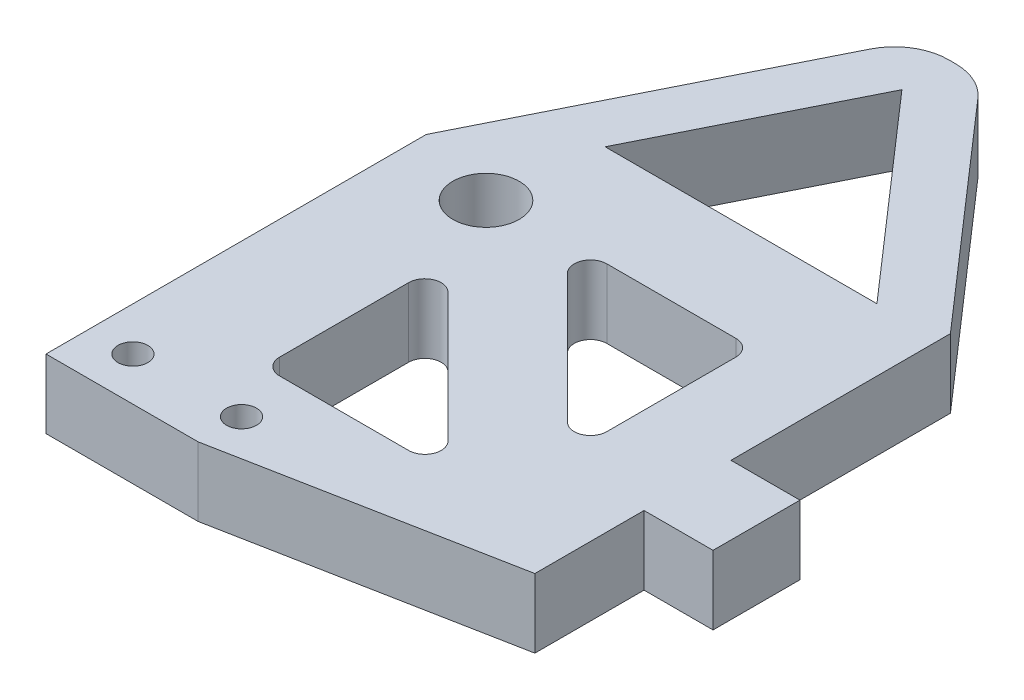
from build123d import *

# Parameters (mm, degrees)
SKETCH1_R           = 6.1
SKETCH1_R_2         = 2.75
BOSS_EXTRUDE1_DEPTH = 12.7
FILLET1_R           = 10
CUT_EXTRUDE1_DEPTH  = 145.780143666


with BuildPart() as part:
    # Sketch1 → Boss-Extrude1 (new body)
    with BuildSketch(Plane(origin=(0, 0, 0), x_dir=(1, 0, 0), z_dir=(0, 1, 0))):
        Polygon((-80, 0), (-80, 60), (-50, 120), (-38, 120), (0, 76.5), (0, 36.1), (12.7, 36.1), (12.7, 20.1), (0, 20.1), (0, 0), (-52, -10), (-80, -10), align=None)
        with Locations((-64, 55)):
            Circle(SKETCH1_R, mode=Mode.SUBTRACT)
        with Locations((-72, -2)):
            Circle(SKETCH1_R_2, mode=Mode.SUBTRACT)
        with Locations((-52, -2)):
            Circle(SKETCH1_R_2, mode=Mode.SUBTRACT)
    extrude(amount=BOSS_EXTRUDE1_DEPTH)

    # Fillet1
    fillet1_edges = [part.edges().sort_by_distance(p)[0] for p in [
        (-38, 6.35, -120),
        (-50, 6.35, -120),
    ]]
    fillet(fillet1_edges, radius=FILLET1_R)

    # Sketch3 → Cut-Extrude1 (cut, through all)
    with BuildSketch(Plane(origin=(0, 12.7, 0), x_dir=(1, 0, 0), z_dir=(0, 1, 0))):
        Polygon((-11.531098959, 74.5), (-43.354786387, 110.929747451), (-61.569660113, 74.5), align=None)
        with BuildLine():
            Line((-58, 34.757359313), (-58, 11))
            ThreePointArc((-58, 11), (-57.121320344, 8.878679656), (-55, 8))
            Line((-55, 8), (-31.242640687, 8))
            ThreePointArc((-31.242640687, 8), (-28.47100209, 9.851949703), (-29.121320344, 13.121320344))
            Line((-29.121320344, 13.121320344), (-52.878679656, 36.878679656))
            ThreePointArc((-52.878679656, 36.878679656), (-56.148050297, 37.52899791), (-58, 34.757359313))
        make_face()
        with BuildLine():
            Line((-16, 29.242640687), (-16, 53))
            ThreePointArc((-16, 53), (-16.878679656, 55.121320344), (-19, 56))
            Line((-19, 56), (-42.757359313, 56))
            ThreePointArc((-42.757359313, 56), (-45.52899791, 54.148050297), (-44.878679656, 50.878679656))
            Line((-44.878679656, 50.878679656), (-21.121320344, 27.121320344))
            ThreePointArc((-21.121320344, 27.121320344), (-17.851949703, 26.47100209), (-16, 29.242640687))
        make_face()
    extrude(amount=-CUT_EXTRUDE1_DEPTH, mode=Mode.SUBTRACT)


solid = part.part
